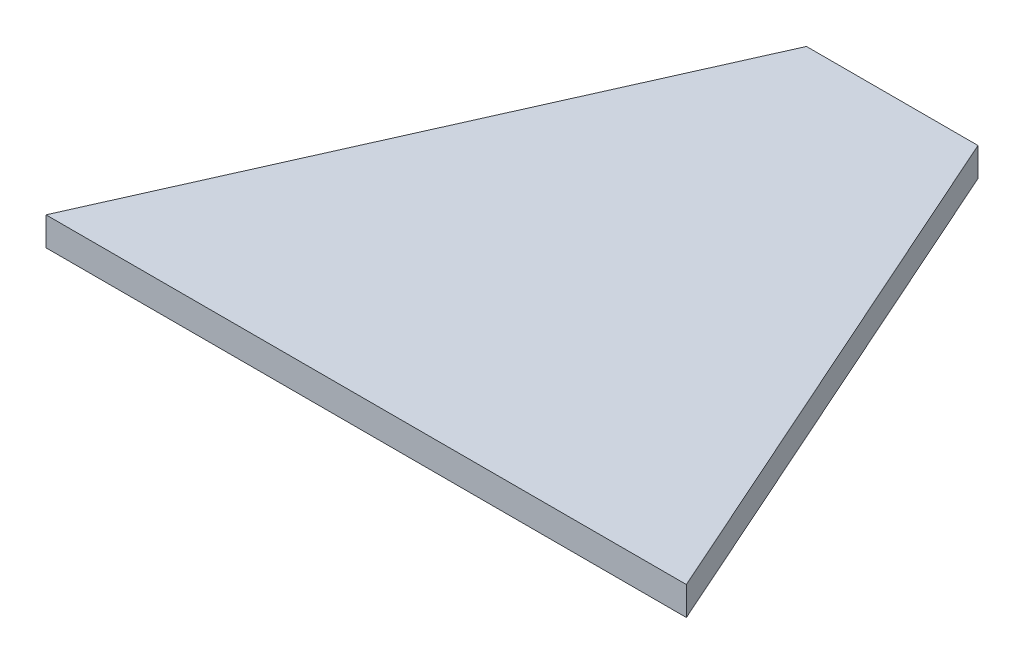
from build123d import *

# Parameters (mm, degrees)
SM_BASE_FLANGE_1_DEPTH = 5


# Sheet-metal steps are written as plain solids
with BuildPart() as part:
    # Sketch 1 → Базовая кромка1 (new body)
    with BuildSketch(Plane(origin=(0, 0, 0), x_dir=(1, 0, 0), z_dir=(0, 1, 0))):
        Polygon((56, 0), (-56, 0), (-15, 92), (15, 92), align=None)
    extrude(amount=SM_BASE_FLANGE_1_DEPTH)


solid = part.part
